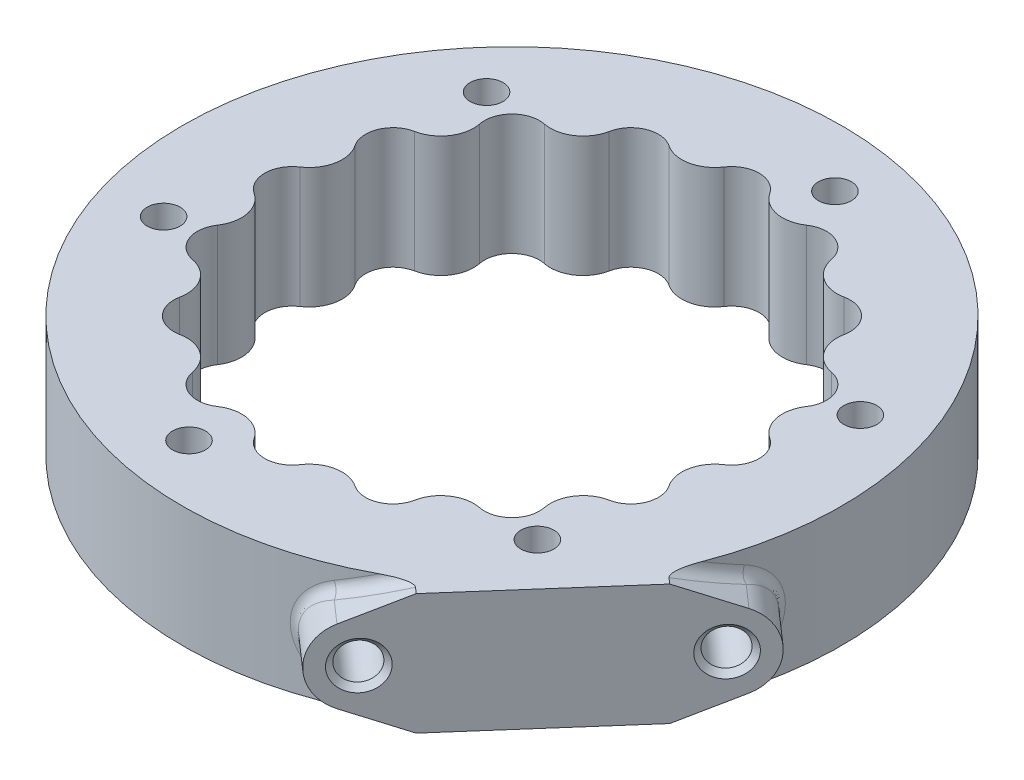
from build123d import *

# Parameters (mm, degrees)
SKETCH1_R                = 60
BOSS_EXTRUDE1_DEPTH      = 22
FILLET1_R                = 5
FILLET2_R                = 6
SKETCH3_R                = 3
CUT_EXTRUDE1_DEPTH       = 88.658428165
BOSS_EXTRUDE3_REACH      = 149.334
BOSS_EXTRUDE3_END_RADIUS = 60
SKETCH7_R                = 3.3
CUT_EXTRUDE3_DEPTH       = 10.5
CHAMFER2_SIZE            = 1
FILLET3_R                = 2
SKETCH8_W                = 32.70355213
SKETCH8_H                = 5.5
CUT_EXTRUDE4_DEPTH       = 149.347998989


with BuildPart() as part:
    # Sketch1 → Boss-Extrude1 (new body)
    with BuildSketch(Plane(origin=(0, 0, 0), x_dir=(1, 0, 0), z_dir=(0, 1, 0))):
        with Locations(Location((0, 0, 0), (0, 0, 270))):
            Circle(SKETCH1_R)
        with BuildLine():
            ThreePointArc((-31.591922188, 24.534678569), (-33.258784492, 22.222809321), (-34.756792584, 19.798115295))
            ThreePointArc((-34.756792584, 19.798115295), (-41.574578963, 17.220754456), (-38.576145309, 10.577382149))
            ThreePointArc((-38.576145309, 10.577382149), (-39.231411216, 7.803612881), (-39.6875, 4.99022482))
            ThreePointArc((-39.6875, 4.99022482), (-45, 0), (-39.6875, -4.99022482))
            ThreePointArc((-39.6875, -4.99022482), (-39.231411216, -7.803612881), (-38.576145309, -10.577382149))
            ThreePointArc((-38.576145309, -10.577382149), (-41.574578963, -17.220754456), (-34.756792584, -19.798115295))
            ThreePointArc((-34.756792584, -19.798115295), (-33.258784492, -22.222809321), (-31.591922188, -24.534678569))
            ThreePointArc((-31.591922188, -24.534678569), (-31.819805153, -31.819805153), (-24.534678569, -31.591922188))
            ThreePointArc((-24.534678569, -31.591922188), (-22.222809321, -33.258784492), (-19.798115295, -34.756792584))
            ThreePointArc((-19.798115295, -34.756792584), (-17.220754456, -41.574578963), (-10.577382149, -38.576145309))
            ThreePointArc((-10.577382149, -38.576145309), (-7.803612881, -39.231411216), (-4.99022482, -39.6875))
            ThreePointArc((-4.99022482, -39.6875), (0, -45), (4.99022482, -39.6875))
            ThreePointArc((4.99022482, -39.6875), (7.803612881, -39.231411216), (10.577382149, -38.576145309))
            ThreePointArc((10.577382149, -38.576145309), (17.220754456, -41.574578963), (19.798115295, -34.756792584))
            ThreePointArc((19.798115295, -34.756792584), (22.222809321, -33.258784492), (24.534678569, -31.591922188))
            ThreePointArc((24.534678569, -31.591922188), (31.819805153, -31.819805153), (31.591922188, -24.534678569))
            ThreePointArc((31.591922188, -24.534678569), (33.258784492, -22.222809321), (34.756792584, -19.798115295))
            ThreePointArc((34.756792584, -19.798115295), (41.574578963, -17.220754456), (38.576145309, -10.577382149))
            ThreePointArc((38.576145309, -10.577382149), (39.231411216, -7.803612881), (39.6875, -4.99022482))
            ThreePointArc((39.6875, -4.99022482), (45, 0), (39.6875, 4.99022482))
            ThreePointArc((39.6875, 4.99022482), (39.231411216, 7.803612881), (38.576145309, 10.577382149))
            ThreePointArc((38.576145309, 10.577382149), (41.574578963, 17.220754456), (34.756792584, 19.798115295))
            ThreePointArc((34.756792584, 19.798115295), (33.258784492, 22.222809321), (31.591922188, 24.534678569))
            ThreePointArc((31.591922188, 24.534678569), (31.819805153, 31.819805153), (24.534678569, 31.591922188))
            ThreePointArc((24.534678569, 31.591922188), (22.222809321, 33.258784492), (19.798115295, 34.756792584))
            ThreePointArc((19.798115295, 34.756792584), (17.220754456, 41.574578963), (10.577382149, 38.576145309))
            ThreePointArc((10.577382149, 38.576145309), (7.803612881, 39.231411216), (4.99022482, 39.6875))
            ThreePointArc((4.99022482, 39.6875), (0, 45), (-4.99022482, 39.6875))
            ThreePointArc((-4.99022482, 39.6875), (-7.803612881, 39.231411216), (-10.577382149, 38.576145309))
            ThreePointArc((-10.577382149, 38.576145309), (-17.220754456, 41.574578963), (-19.798115295, 34.756792584))
            ThreePointArc((-19.798115295, 34.756792584), (-22.222809321, 33.258784492), (-24.534678569, 31.591922188))
            ThreePointArc((-24.534678569, 31.591922188), (-31.819805153, 31.819805153), (-31.591922188, 24.534678569))
        make_face(mode=Mode.SUBTRACT)
    extrude(amount=BOSS_EXTRUDE1_DEPTH)

    # Fillet1
    # the kernel refuses this fillet: 5 mm, written as the material it takes off along each edge
    with BuildSketch(Plane(origin=(-31.591922188, -7.937782114, -24.534678569), x_dir=(-0.5708127348451637, 0, -0.8210802772802334), z_dir=(0, 1, 0))) as fillet1_piece_1:
        with BuildLine():
            CenterArc((3.572001951, 4.856162203), FILLET1_R, 201.908932705, 54.314665287)
            ThreePointArc((-1.066888508, 2.990500041), (-0.503760138, 1.505840103), (0, 0))
            ThreePointArc((0, 0), (1.190667317, 0.143837797), (2.381334634, 0))
        make_face()
    extrude(amount=37.875564228, mode=Mode.SUBTRACT)
    with BuildSketch(Plane(origin=(-34.756792584, -7.937782114, -19.798115295), x_dir=(-0.977019839336146, 0, -0.21314838386338178), z_dir=(0, 1, 0)), Plane(origin=(10.577382149, -7.937782114, 38.576145309), x_dir=(0.5401386861196337, 0, 0.8415760213771278), z_dir=(0, 1, 0)), Plane(origin=(-4.99022482, -7.937782114, 39.6875), x_dir=(0.176965876366712, 0, 0.984216987560041), z_dir=(0, 1, 0)), Plane(origin=(-19.798115295, -7.937782114, 34.756792584), x_dir=(-0.21314838386337953, 0, 0.9770198393361466), z_dir=(0, 1, 0)), Plane(origin=(-31.591922188, -7.937782114, 24.534678569), x_dir=(-0.5708127348451787, 0, 0.8210802772802229), z_dir=(0, 1, 0)), Plane(origin=(-38.576145309, -7.937782114, 10.577382149), x_dir=(-0.84157602137713, 0, 0.5401386861196305), z_dir=(0, 1, 0)), Plane(origin=(-39.6875, -7.937782114, -4.99022482), x_dir=(-0.9842169875600411, 0, 0.17696587636671054), z_dir=(0, 1, 0)), Plane(origin=(24.534678569, -7.937782114, 31.591922188), x_dir=(0.8210802772802258, 0, 0.5708127348451744), z_dir=(0, 1, 0)), Plane(origin=(34.756792584, -7.937782114, 19.798115295), x_dir=(0.9770198393361469, 0, 0.2131483838633775), z_dir=(0, 1, 0)), Plane(origin=(39.6875, -7.937782114, 4.99022482), x_dir=(0.9842169875600401, 0, -0.1769658763667165), z_dir=(0, 1, 0)), Plane(origin=(38.576145309, -7.937782114, -10.577382149), x_dir=(0.8415760213771245, 0, -0.5401386861196388), z_dir=(0, 1, 0)), Plane(origin=(31.591922188, -7.937782114, -24.534678569), x_dir=(0.5708127348451758, 0, -0.8210802772802248), z_dir=(0, 1, 0)), Plane(origin=(19.798115295, -7.937782114, -34.756792584), x_dir=(0.21314838386337198, 0, -0.9770198393361482), z_dir=(0, 1, 0)), Plane(origin=(4.99022482, -7.937782114, -39.6875), x_dir=(-0.17696587636672031, 0, -0.9842169875600394), z_dir=(0, 1, 0)), Plane(origin=(-10.577382149, -7.937782114, -38.576145309), x_dir=(-0.5401386861196261, 0, -0.8415760213771326), z_dir=(0, 1, 0)), Plane(origin=(-24.534678569, -7.937782114, -31.591922188), x_dir=(-0.82108027728022, 0, -0.5708127348451829), z_dir=(0, 1, 0))) as fillet1_piece_2:
        with BuildLine():
            CenterArc((3.572001951, -4.856162203), FILLET1_R, 103.776402008, 54.314665287)
            ThreePointArc((-1.066888508, -2.990500041), (-0.503760138, -1.505840103), (0, 0))
            ThreePointArc((0, 0), (1.190667317, -0.143837797), (2.381334634, 0))
        make_face()
    extrude(amount=37.875564228, mode=Mode.SUBTRACT)
    with BuildSketch(Plane(origin=(4.99022482, -7.937782114, 39.6875), x_dir=(0.9864543257067245, 0, -0.1640361645933343), z_dir=(0, 1, 0)), Plane(origin=(-10.577382149, -7.937782114, 38.576145309), x_dir=(0.9741388837762464, 0, 0.22595007217340898), z_dir=(0, 1, 0)), Plane(origin=(-24.534678569, -7.937782114, 31.591922188), x_dir=(0.8135196273818055, 0, 0.5815374586942516), z_dir=(0, 1, 0)), Plane(origin=(-34.756792584, -7.937782114, 19.798115295), x_dir=(0.5290493822922732, 0, 0.8485910387790836), z_dir=(0, 1, 0)), Plane(origin=(-39.6875, -7.937782114, 4.99022482), x_dir=(0.1640361645933272, 0, 0.9864543257067256), z_dir=(0, 1, 0)), Plane(origin=(-38.576145309, -7.937782114, -10.577382149), x_dir=(-0.22595007217340937, 0, 0.9741388837762464), z_dir=(0, 1, 0)), Plane(origin=(19.798115295, -7.937782114, 34.756792584), x_dir=(0.8485910387790846, 0, -0.5290493822922715), z_dir=(0, 1, 0)), Plane(origin=(31.591922188, -7.937782114, 24.534678569), x_dir=(0.5815374586942491, 0, -0.8135196273818073), z_dir=(0, 1, 0)), Plane(origin=(38.576145309, -7.937782114, 10.577382149), x_dir=(0.22595007217340277, 0, -0.9741388837762479), z_dir=(0, 1, 0)), Plane(origin=(39.6875, -7.937782114, -4.99022482), x_dir=(-0.16403616459333684, 0, -0.9864543257067241), z_dir=(0, 1, 0)), Plane(origin=(34.756792584, -7.937782114, -19.798115295), x_dir=(-0.5290493822922758, 0, -0.8485910387790819), z_dir=(0, 1, 0)), Plane(origin=(24.534678569, -7.937782114, -31.591922188), x_dir=(-0.8135196273818096, 0, -0.5815374586942458), z_dir=(0, 1, 0)), Plane(origin=(10.577382149, -7.937782114, -38.576145309), x_dir=(-0.9741388837762485, 0, -0.22595007217340046), z_dir=(0, 1, 0)), Plane(origin=(-4.99022482, -7.937782114, -39.6875), x_dir=(-0.9864543257067236, 0, 0.16403616459333964), z_dir=(0, 1, 0)), Plane(origin=(-19.798115295, -7.937782114, -34.756792584), x_dir=(-0.8485910387790874, 0, 0.5290493822922673), z_dir=(0, 1, 0))) as fillet1_piece_3:
        with BuildLine():
            CenterArc((3.373557398, -4.996060424), FILLET1_R, 92.274604499, 54.314665287)
            ThreePointArc((-0.800166381, -2.24287503), (-0.264608655, -1.169769307), (0, 0))
            ThreePointArc((0, 0), (1.587556423, -0.031516609), (3.175112846, 0))
        make_face()
    extrude(amount=37.875564228, mode=Mode.SUBTRACT)

    # Fillet2
    fillet2_edges = [part.edges().sort_by_distance(p)[0] for p in [
        (-7.805937782, 11, 39.243099283),
        (7.805937782, 11, 39.243099283),
        (22.229430079, 11, 33.268693157),
        (33.268693157, 11, 22.229430079),
        (-22.229430079, 11, 33.268693157),
        (-33.268693157, 11, 22.229430079),
        (-39.243099283, 11, 7.805937782),
        (-39.243099283, 11, -7.805937782),
        (39.243099283, 11, 7.805937782),
        (39.243099283, 11, -7.805937782),
        (33.268693157, 11, -22.229430079),
        (22.229430079, 11, -33.268693157),
        (7.805937782, 11, -39.243099283),
        (-7.805937782, 11, -39.243099283),
        (-22.229430079, 11, -33.268693157),
        (-33.268693157, 11, -22.229430079),
    ]]
    fillet(fillet2_edges, radius=FILLET2_R)

    # Sketch3 → Cut-Extrude1 (cut, through all)
    with BuildSketch(Plane(origin=(0, 22, 0), x_dir=(1, 0, 0), z_dir=(0, 1, 0))):
        with Locations(Location((9.754516101, 49.03926402, 0), (0, 0, 270))):
            Circle(SKETCH3_R)
        with Locations(Location((47.346506475, 16.071973265, 0), (0, 0, 270))):
            Circle(SKETCH3_R)
        with Locations(Location((37.591990374, -32.967290755, 0), (0, 0, 270))):
            Circle(SKETCH3_R)
        with Locations(Location((-9.754516101, -49.03926402, 0), (0, 0, 270))):
            Circle(SKETCH3_R)
        with Locations(Location((-47.346506475, -16.071973265, 0), (0, 0, 270))):
            Circle(SKETCH3_R)
        with Locations(Location((-37.591990374, 32.967290755, 0), (0, 0, 270))):
            Circle(SKETCH3_R)
    extrude(amount=-CUT_EXTRUDE1_DEPTH, mode=Mode.SUBTRACT)

    # Boss-Extrude3: up to this cylinder (the profile starts outside it)
    boss_extrude3_end = Plane(origin=(0, 11, 0), z_dir=(0, -1, 0)) * Cylinder(BOSS_EXTRUDE3_END_RADIUS, 419.668, mode=Mode.PRIVATE)
    # Sketch6 → Boss-Extrude3 (add, up to the surface)
    with BuildSketch(Plane(origin=(48.322940338, 0, 37.41419036), x_dir=(-0.6593458151000848, 0, 0.7518398074789634), z_dir=(-0.7518398074789634, 0, -0.6593458151000848)), mode=Mode.PRIVATE) as boss_extrude3_sk1:
        with BuildLine():
            Line((-22.841633403, 17.677522556), (-2.694264982, 26.197120299))
            ThreePointArc((-2.694264982, 26.197120299), (3.732050808, 27.5), (10.158366597, 26.197120299))
            Line((10.158366597, 26.197120299), (30.305735018, 17.677522556))
            ThreePointArc((30.305735018, 17.677522556), (34.732050808, 11), (30.305735018, 4.322477444))
            Line((30.305735018, 4.322477444), (10.158366597, -4.197120299))
            ThreePointArc((10.158366597, -4.197120299), (3.732050808, -5.5), (-2.694264982, -4.197120299))
            Line((-2.694264982, -4.197120299), (-22.841633403, 4.322477444))
            ThreePointArc((-22.841633403, 4.322477444), (-27.267949192, 11), (-22.841633403, 17.677522556))
        make_face()
    boss_extrude3_tool1 = extrude(boss_extrude3_sk1.sketch, amount=BOSS_EXTRUDE3_REACH, mode=Mode.PRIVATE) - boss_extrude3_end
    add(boss_extrude3_tool1.solids().sort_by_distance((45.862228, 11, 40.220095))[0])

    # Sketch7 → Cut-Extrude3 (cut)
    with BuildSketch(Plane(origin=(45.862228256, 0, 40.220094721), x_dir=(0.6593458151000849, 0, -0.7518398074789633), z_dir=(0.7518398074789633, 0, 0.6593458151000849))):
        with Locations((23.75, 11)):
            Circle(SKETCH7_R)
        with Locations((-23.75, 11)):
            Circle(SKETCH7_R)
    extrude(amount=-CUT_EXTRUDE3_DEPTH, mode=Mode.SUBTRACT)

    # Chamfer2
    chamfer2_edges = [part.edges().sort_by_distance(p)[0] for p in [
        (59.345850175, 11, 24.844970658),
        (28.026923958, 11, 60.557361513),
    ]]
    chamfer(chamfer2_edges, length=CHAMFER2_SIZE)

    # Fillet3
    fillet3_edges = [part.edges().sort_by_distance(p)[0] for p in [
        (56.305748885, 19.805835114, 20.728305345),
        (27.900346821, 2.194164886, 53.11845863),
        (59.062632001, 11, 10.564350485),
        (56.305748885, 2.194164886, 20.728305345),
        (18.18319146, 11, 57.178418554),
        (27.900346821, 19.805835114, 53.11845863),
    ]]
    fillet(fillet3_edges, radius=FILLET3_R)

    # Sketch8 → Cut-Extrude4 (cut, through all)
    with BuildSketch(Plane(origin=(45.862228256, 0, 40.220094721), x_dir=(0.6593458151000848, 0, -0.7518398074789634), z_dir=(0.7518398074789634, 0, 0.6593458151000848))):
        with Locations((0, 24.75)):
            Rectangle(SKETCH8_W, SKETCH8_H)
        with Locations((0, -2.75)):
            Rectangle(SKETCH8_W, SKETCH8_H)
    extrude(amount=-CUT_EXTRUDE4_DEPTH, mode=Mode.SUBTRACT)


solid = part.part
